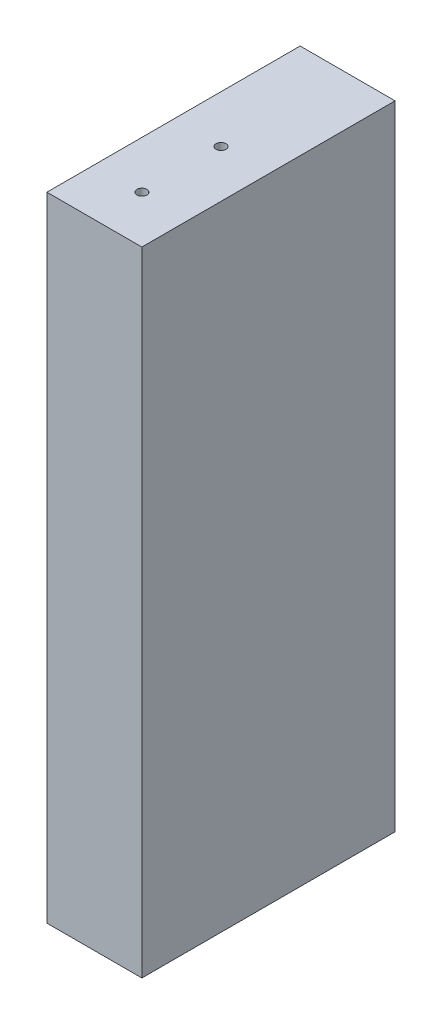
from build123d import *

# Parameters (mm, degrees)
SKETCH1_W                           = 19.05
SKETCH1_H                           = 126.999999888
BOSS_EXTRUDE1_DEPTH                 = 50.8
F_5_64_0_07813_DIAMETER_HOLE1_D     = 1.984502
F_5_64_0_07813_DIAMETER_HOLE1_DEPTH = 38.1
F_5_64_0_07813_DIAMETER_HOLE1_TIP   = 0.59620455
F_5_64_0_07813_DIAMETER_HOLE6_D     = 1.984502
F_5_64_0_07813_DIAMETER_HOLE6_DEPTH = 19.05
F_5_64_0_07813_DIAMETER_HOLE6_TIP   = 0.59620455
F_5_64_0_07813_DIAMETER_HOLE7_D     = 1.984502
F_5_64_0_07813_DIAMETER_HOLE7_DEPTH = 19.05
F_5_64_0_07813_DIAMETER_HOLE7_TIP   = 0.59620455


with BuildPart() as part:
    # Sketch1 → Boss-Extrude1 (new body)
    with BuildSketch(Plane.XY):
        with Locations((377.144680647, 6006.134818763)):
            Rectangle(SKETCH1_W, SKETCH1_H)
    extrude(amount=BOSS_EXTRUDE1_DEPTH)

    # 5/64 (0.07813) Diameter Hole1
    with Locations(Plane(origin=(-83.853965539, -12.395181178, -19.050087596), x_dir=(-1, 0, 0), z_dir=(0, 1.3770507333441827e-10, -1.0))):
        with Locations((-481.589248274, 6993.254992531), (-386.339248274, 6993.254992531), (-291.089248274, 6993.254992531), (-295.274999999, 6965.135938474), (-295.274999999, 6812.735938474), (-295.274999999, 6660.335938474), (-285.166362357, 6631.468843414), (-475.477307398, 6631.468752771), (-485.002307398, 6660.335938474), (-485.002307398, 6812.735938474), (-485.002307398, 6965.135938474), (-478.365617646, 6611.6708), (-287.865617646, 6611.6708), (-307.975, 6564.3379), (-307.975, 6488.1379), (-284.960913066, 6440.805), (-380.210913066, 6440.805), (-475.460913066, 6440.805), (-446.831312422, 6488.1379), (-446.831312422, 6564.3379), (-472.231312422, 6396.355), (-472.231312422, 6320.155), (-472.653156211, 6275.705000839), (-377.403156211, 6275.705000839), (-282.153156211, 6275.705000839), (-282.575, 6320.155), (-282.575, 6396.355), (-435.598646187, 6221.729999816), (-435.598646187, 6145.529999816), (-450.592518112, 6091.554999951), (-460.998646187, 6091.555478285), (-460.998646187, 6056.629999944), (-460.998646187, 5980.429999944), (-460.998646187, 5945.505000042), (-282.153156211, 5945.505000042), (-368.611823093, 5945.505000042)):
            Hole(F_5_64_0_07813_DIAMETER_HOLE1_D / 2, depth=F_5_64_0_07813_DIAMETER_HOLE1_DEPTH)
            with Locations((0, 0, -(F_5_64_0_07813_DIAMETER_HOLE1_DEPTH + F_5_64_0_07813_DIAMETER_HOLE1_TIP / 2))):  # 118° drill point
                Cone(0, F_5_64_0_07813_DIAMETER_HOLE1_D / 2, F_5_64_0_07813_DIAMETER_HOLE1_TIP, mode=Mode.SUBTRACT)

    # 5/64 (0.07813) Diameter Hole6
    with Locations(Plane(origin=(0, 5942.634818819, 0), x_dir=(-1, 0, 0), z_dir=(0, -1, 0))):
        with Locations((-377.144680647, -41.274997961), (-377.144680647, -25.399997961)):
            Hole(F_5_64_0_07813_DIAMETER_HOLE6_D / 2, depth=F_5_64_0_07813_DIAMETER_HOLE6_DEPTH)
            with Locations((0, 0, -(F_5_64_0_07813_DIAMETER_HOLE6_DEPTH + F_5_64_0_07813_DIAMETER_HOLE6_TIP / 2))):  # 118° drill point
                Cone(0, F_5_64_0_07813_DIAMETER_HOLE6_D / 2, F_5_64_0_07813_DIAMETER_HOLE6_TIP, mode=Mode.SUBTRACT)

    # 5/64 (0.07813) Diameter Hole7
    with Locations(Plane(origin=(0, 6069.634818707, 0), x_dir=(1, 0, 0), z_dir=(0, 1, 0))):
        with Locations((377.144680647, -41.274997961), (377.144680647, -25.399997961)):
            Hole(F_5_64_0_07813_DIAMETER_HOLE7_D / 2, depth=F_5_64_0_07813_DIAMETER_HOLE7_DEPTH)
            with Locations((0, 0, -(F_5_64_0_07813_DIAMETER_HOLE7_DEPTH + F_5_64_0_07813_DIAMETER_HOLE7_TIP / 2))):  # 118° drill point
                Cone(0, F_5_64_0_07813_DIAMETER_HOLE7_D / 2, F_5_64_0_07813_DIAMETER_HOLE7_TIP, mode=Mode.SUBTRACT)


solid = part.part
